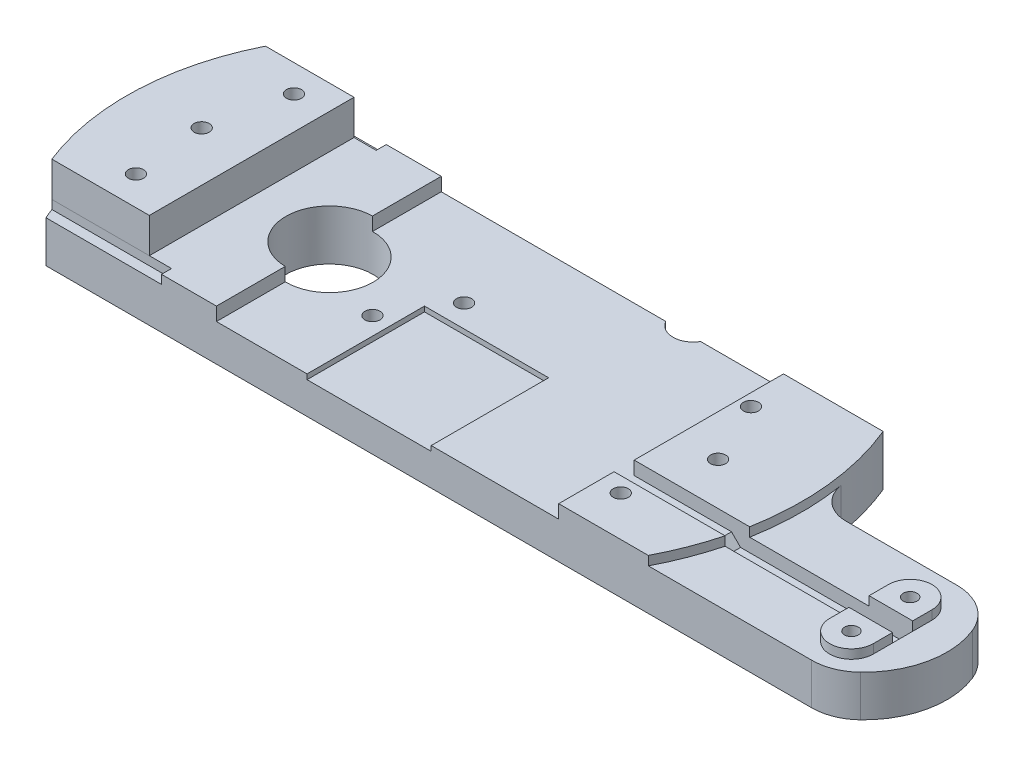
from build123d import *

# Parameters (mm, degrees)
SKETCH1_W           = 195
SKETCH1_H           = 67
BOSS_EXTRUDE1_DEPTH = 25.4
CUT_EXTRUDE1_DEPTH  = 107.177492907
CUT_EXTRUDE2_DEPTH  = 121.997561959
CUT_EXTRUDE3_START  = -13
SKETCH4_W           = 6.612655346
SKETCH4_H           = 3
CUT_EXTRUDE3_DEPTH  = 13
SKETCH6_R           = 2.25
CUT_EXTRUDE4_DEPTH  = 107.177492907
SKETCH7_W           = 37
SKETCH7_H           = 35
CUT_EXTRUDE5_DEPTH  = 1.5
CUT_EXTRUDE6_DEPTH  = 18.5
SKETCH9_R           = 2.05
BOSS_EXTRUDE2_DEPTH = 12.3
FILLET1_R           = 10
SKETCH10_R          = 13
CUT_EXTRUDE7_DEPTH  = 161.89488962
SKETCH11_R          = 2.05
BOSS_EXTRUDE3_DEPTH = 2.7
CUT_EXTRUDE8_DEPTH  = 6


# Read off the part's stored shape, not the designer's step: Split1
with BuildPart() as part:
    # Sketch1 → Boss-Extrude1 (new body)
    with BuildSketch(Plane(origin=(0, 0, 0), x_dir=(1, 0, 0), z_dir=(0, 1, 0))):
        Rectangle(SKETCH1_W, SKETCH1_H)
    extrude(amount=BOSS_EXTRUDE1_DEPTH)

    # Sketch2 → Cut-Extrude1 (cut, through all)
    with BuildSketch(Plane.XZ):
        with BuildLine():
            Line((97.5, -3.219751644), (97.5, 33.5))
            Line((97.5, 33.5), (88.5, 33.5))
            ThreePointArc((88.5, 33.5), (95.217186872, 15.683556008), (97.5, -3.219751644))
        make_face()
        with BuildLine():
            Line((97.5, -33.5), (97.5, -3.219751644))
            ThreePointArc((97.5, -3.219751644), (95.985558513, -18.65423771), (91.5, -33.5))
            Line((91.5, -33.5), (97.5, -33.5))
        make_face()
        with BuildLine():
            ThreePointArc((-88, -33.5), (-95.08607052, -15.861694529), (-97.5, 2.992884749))
            Line((-97.5, 2.992884749), (-97.5, -33.5))
            Line((-97.5, -33.5), (-88, -33.5))
        make_face()
        with BuildLine():
            ThreePointArc((-97.5, 2.992884749), (-95.856964648, 18.588830376), (-91, 33.5))
            Line((-91, 33.5), (-97.5, 33.5))
            Line((-97.5, 33.5), (-97.5, 2.992884749))
        make_face()
    extrude(amount=-CUT_EXTRUDE1_DEPTH, mode=Mode.SUBTRACT)

    # Sketch3 → Cut-Extrude2 (cut, through all)
    with BuildSketch(Plane(origin=(0, 0, 33.5), x_dir=(-1, 0, 0), z_dir=(0, 0, -1))):
        Polygon((63.2, 25.4), (63.2, 15), (40.2, 15), (40.2, 11), (-61.8, 11), (-61.8, 15), (-97.5, 15), (-97.5, 25.4), align=None)
    extrude(amount=CUT_EXTRUDE2_DEPTH, mode=Mode.SUBTRACT)

    # Sketch4 → Cut-Extrude3 (cut)
    with BuildSketch(Plane(origin=(0, 25.4, 0), x_dir=(1, 0, 0), z_dir=(0, 1, 0)).offset(CUT_EXTRUDE3_START)):
        with BuildLine():
            Line((-63.2, 30.5), (-63.2, 33.5))
            Line((-63.2, 33.5), (-88, 33.5))
            ThreePointArc((-88, 33.5), (-88.810680862, 32.008999469), (-89.587344654, 30.5))
            Line((-89.587344654, 30.5), (-63.2, 30.5))
        make_face()
        with Locations((-59.893672327, 32)):
            Rectangle(SKETCH4_W, SKETCH4_H)
        with BuildLine():
            Line((-63.2, -33.5), (-63.2, -30.5))
            Line((-63.2, -30.5), (-92.261692194, -30.5))
            ThreePointArc((-92.261692194, -30.5), (-91.647155152, -32.006859002), (-91, -33.5))
            Line((-91, -33.5), (-63.2, -33.5))
        make_face()
        with Locations((-59.893672327, -32)):
            Rectangle(SKETCH4_W, SKETCH4_H)
    extrude(amount=CUT_EXTRUDE3_DEPTH, mode=Mode.SUBTRACT)

    # Sketch6 → Cut-Extrude4 (cut, through all)
    with BuildSketch(Plane.XZ):
        with Locations(Location((-18.5, 8.7, 0), (0, 0, 270))):
            Circle(SKETCH6_R)
        with Locations(Location((74.1, -1.7, 0), (0, 0, 270))):
            Circle(SKETCH6_R)
        with Locations(Location((68.3, 21.5, 0), (0, 0, 270))):
            Circle(SKETCH6_R)
        with Locations(Location((65.4, -20.2, 0), (0, 0, 270))):
            Circle(SKETCH6_R)
        with Locations(Location((-8.1, -8.2, 0), (0, 0, 270))):
            Circle(SKETCH6_R)
        with Locations(Location((-75.9, 21.8, 0), (0, 0, 270))):
            Circle(SKETCH6_R)
        with Locations(Location((-78, 0.1, 0), (0, 0, 270))):
            Circle(SKETCH6_R)
        with Locations(Location((-73, -22.4, 0), (0, 0, 270))):
            Circle(SKETCH6_R)
    extrude(amount=-CUT_EXTRUDE4_DEPTH, mode=Mode.SUBTRACT)

    # Sketch7 → Cut-Extrude5 (cut)
    with BuildSketch(Plane(origin=(0, 11, 0), x_dir=(1, 0, 0), z_dir=(0, 1, 0))):
        with Locations((5.3, -16)):
            Rectangle(SKETCH7_W, SKETCH7_H)
    extrude(amount=-CUT_EXTRUDE5_DEPTH, mode=Mode.SUBTRACT)

    # Sketch8 → Cut-Extrude6 (cut)
    with BuildSketch(Plane(origin=(0, 25.4, 0), x_dir=(1, 0, 0), z_dir=(0, 1, 0))):
        with BuildLine():
            Line((37.096152423, 33.5), (31.9, 33.5))
            Line((31.9, 33.5), (31.9, 30.5))
            ThreePointArc((31.9, 30.5), (34.9, 31.303847577), (37.096152423, 33.5))
        make_face()
        with BuildLine():
            Line((31.9, 33.5), (26.703847577, 33.5))
            ThreePointArc((26.703847577, 33.5), (28.9, 31.303847577), (31.9, 30.5))
            Line((31.9, 30.5), (31.9, 33.5))
        make_face()
    extrude(amount=-CUT_EXTRUDE6_DEPTH, mode=Mode.SUBTRACT)

    # Sketch9 → Boss-Extrude2 (add)
    with BuildSketch(Plane.XZ):
        with BuildLine():
            Line((88.5, 33.5), (137.200361796, 33.5))
            ThreePointArc((137.200361796, 33.5), (142.769729546, 32.427747228), (147.542861296, 29.364285714))
            ThreePointArc((147.542861296, 29.364285714), (154.743476693, 16.527679502), (153.473750823, 1.864285714))
            ThreePointArc((153.473750823, 1.864285714), (147.953179578, -4.940573023), (139.572717606, -7.5))
            Line((139.572717606, -7.5), (97.384558849, -7.5))
            ThreePointArc((97.384558849, -7.5), (95.698800641, 13.597328658), (88.5, 33.5))
        make_face()
        with Locations(Location((138.3, 5.25, 0), (0, 0, 270))):
            Circle(SKETCH9_R, mode=Mode.SUBTRACT)
        with Locations(Location((138.3, 22.75, 0), (0, 0, 270))):
            Circle(SKETCH9_R, mode=Mode.SUBTRACT)
    extrude(amount=-BOSS_EXTRUDE2_DEPTH)

    # Fillet1
    fillet1_edges = [part.edges().sort_by_distance(p)[0] for p in [
        (97.384558849, 6.15, -7.5),
    ]]
    fillet(fillet1_edges, radius=FILLET1_R)

    # Sketch10 → Cut-Extrude7 (cut, through all)
    with BuildSketch(Plane.XZ):
        with Locations(Location((-40.017782272, 0, 0), (0, 0, 270))):
            Circle(SKETCH10_R)
    extrude(amount=-CUT_EXTRUDE7_DEPTH, mode=Mode.SUBTRACT)

    # Sketch11 → Boss-Extrude3 (add)
    # profile 1 of 2: a face of its own
    with BuildSketch(Plane(origin=(0, 12.3, 0), x_dir=(1, 0, 0), z_dir=(0, 1, 0))):
        with BuildLine():
            Line((144.8, -11), (144.8, -5.25))
            ThreePointArc((144.8, -5.25), (138.3, 1.25), (131.8, -5.25))
            Line((131.8, -5.25), (131.8, -11))
            Line((131.8, -11), (144.8, -11))
        make_face()
        with Locations(Location((138.3, -5.25, 0), (0, 0, 90))):
            Circle(SKETCH11_R, mode=Mode.SUBTRACT)
    # profile 2 of 2: a face of its own
    with BuildSketch(Plane(origin=(0, 12.3, 0), x_dir=(1, 0, 0), z_dir=(0, 1, 0))):
        with BuildLine():
            Line((144.8, -22.75), (144.8, -17))
            Line((144.8, -17), (131.8, -17))
            Line((131.8, -17), (131.8, -22.75))
            ThreePointArc((131.8, -22.75), (138.3, -29.25), (144.8, -22.75))
        make_face()
        with Locations(Location((138.3, -22.75, 0), (0, 0, 90))):
            Circle(SKETCH11_R, mode=Mode.SUBTRACT)
    extrude(amount=BOSS_EXTRUDE3_DEPTH)

    # Sketch12 → Cut-Extrude8 (cut)
    with BuildSketch(Plane.XY.offset(11)):
        Polygon((144.8, 15), (144.8, 8.3), (93.5, 8.3), (90.8, 11), (61.8, 11), (61.8, 15), align=None)
    extrude(amount=CUT_EXTRUDE8_DEPTH, mode=Mode.SUBTRACT)


with BuildPart() as body_2:
    # Split1: the piece on the far side of the plane
    add(part.part)
    split(bisect_by=Plane(origin=(0, 15, 0), x_dir=(1, 0, 0), z_dir=(0, 1, 0)), keep=Keep.BOTTOM)


with BuildPart() as part_1:
    add(part.part)

    # Split1
    split(bisect_by=Plane(origin=(0, 15, 0), x_dir=(1, 0, 0), z_dir=(0, 1, 0)), keep=Keep.TOP)


solid = Compound([body_2.part, part_1.part])
